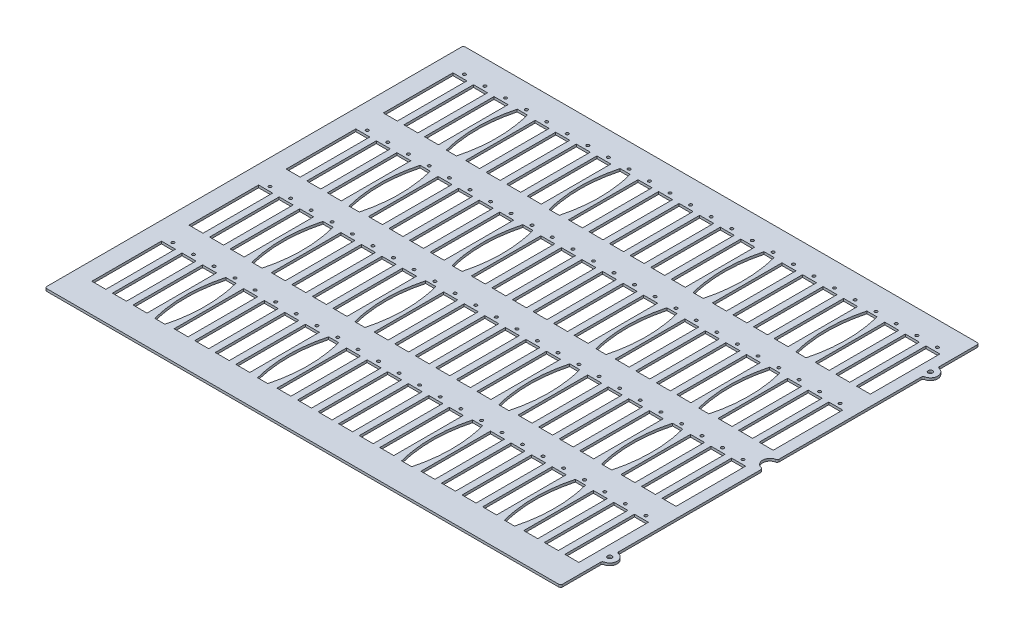
from build123d import *

# Parameters (mm, degrees)
BOSS_EXTRUDE1_DEPTH        = 3.175
SKETCH2_R                  = 1.905
SKETCH2_W                  = 18.288
SKETCH2_H                  = 90.932
CUT_EXTRUDE1_DEPTH         = 3.175
SKETCH3_R                  = 1.905
CUT_EXTRUDE2_DEPTH         = 3.175
F_1_0_228_DIAMETER_HOLE1_D = 5.7912
FILLET1_R                  = 2.54


with BuildPart() as part:
    # Sketch1 → Boss-Extrude1 (new body)
    with BuildSketch(Plane(origin=(0, 0, 0), x_dir=(1, 0, 0), z_dir=(0, 1, 0))):
        with BuildLine():
            Line((337.058, 219.456), (337.058, 273.558))
            Line((337.058, 273.558), (-337.058, 273.558))
            Line((-337.058, 273.558), (-337.058, -273.558))
            Line((-337.058, -273.558), (337.058, -273.558))
            Line((337.058, -273.558), (337.058, -218.948))
            ThreePointArc((337.058, -218.948), (346.71, -209.296), (337.058, -199.644))
            Line((337.058, -199.644), (337.058, -9.398))
            ThreePointArc((337.058, -9.398), (327.406, 0.254), (337.058, 9.906))
            Line((337.058, 9.906), (337.058, 200.152))
            ThreePointArc((337.058, 200.152), (346.71, 209.804), (337.058, 219.456))
        make_face()
    extrude(amount=BOSS_EXTRUDE1_DEPTH)

    # Sketch2 → Cut-Extrude1 (cut)
    with BuildSketch(Plane(origin=(0, 3.175, 0), x_dir=(1, 0, 0), z_dir=(0, 1, 0))):
        with Locations((-304.313166667, 242.062)):
            Circle(SKETCH2_R)
        with Locations((-277.4315, 242.062)):
            Circle(SKETCH2_R)
        with Locations((-250.549833333, 242.062)):
            Circle(SKETCH2_R)
        with Locations((-196.7865, 242.062)):
            Circle(SKETCH2_R)
        with Locations((-169.904833333, 242.062)):
            Circle(SKETCH2_R)
        with Locations((-143.023166667, 242.062)):
            Circle(SKETCH2_R)
        with Locations((-116.1415, 242.062)):
            Circle(SKETCH2_R)
        with Locations((-62.378166667, 242.062)):
            Circle(SKETCH2_R)
        with Locations((-35.4965, 242.062)):
            Circle(SKETCH2_R)
        with Locations((-8.614833333, 242.062)):
            Circle(SKETCH2_R)
        with Locations((18.266833333, 242.062)):
            Circle(SKETCH2_R)
        with Locations((45.1485, 242.062)):
            Circle(SKETCH2_R)
        with Locations((72.030166667, 242.062)):
            Circle(SKETCH2_R)
        with Locations((125.7935, 242.062)):
            Circle(SKETCH2_R)
        with Locations((152.675166667, 242.062)):
            Circle(SKETCH2_R)
        with Locations((179.556833333, 242.062)):
            Circle(SKETCH2_R)
        with Locations((206.4385, 242.062)):
            Circle(SKETCH2_R)
        with Locations((260.201833333, 242.062)):
            Circle(SKETCH2_R)
        with Locations((287.0835, 242.062)):
            Circle(SKETCH2_R)
        with Locations((313.965166667, 242.062)):
            Circle(SKETCH2_R)
        with Locations((-277.4315, 115.062)):
            Circle(SKETCH2_R)
        with Locations((-250.549833333, 115.062)):
            Circle(SKETCH2_R)
        with Locations((-196.7865, 115.062)):
            Circle(SKETCH2_R)
        with Locations((-169.904833333, 115.062)):
            Circle(SKETCH2_R)
        with Locations((-143.023166667, 115.062)):
            Circle(SKETCH2_R)
        with Locations((-116.1415, 115.062)):
            Circle(SKETCH2_R)
        with Locations((-62.378166667, 115.062)):
            Circle(SKETCH2_R)
        with Locations((-35.4965, 115.062)):
            Circle(SKETCH2_R)
        with Locations((-8.614833333, 115.062)):
            Circle(SKETCH2_R)
        with Locations((18.266833333, 115.062)):
            Circle(SKETCH2_R)
        with Locations((45.1485, 115.062)):
            Circle(SKETCH2_R)
        with Locations((72.030166667, 115.062)):
            Circle(SKETCH2_R)
        with Locations((125.7935, 115.062)):
            Circle(SKETCH2_R)
        with Locations((152.675166667, 115.062)):
            Circle(SKETCH2_R)
        with Locations((179.556833333, 115.062)):
            Circle(SKETCH2_R)
        with Locations((206.4385, 115.062)):
            Circle(SKETCH2_R)
        with Locations((260.201833333, 115.062)):
            Circle(SKETCH2_R)
        with Locations((287.0835, 115.062)):
            Circle(SKETCH2_R)
        with Locations((313.965166667, 115.062)):
            Circle(SKETCH2_R)
        with Locations((-277.4315, -11.938)):
            Circle(SKETCH2_R)
        with Locations((-250.549833333, -11.938)):
            Circle(SKETCH2_R)
        with Locations((-196.7865, -11.938)):
            Circle(SKETCH2_R)
        with Locations((-169.904833333, -11.938)):
            Circle(SKETCH2_R)
        with Locations((-143.023166667, -11.938)):
            Circle(SKETCH2_R)
        with Locations((-116.1415, -11.938)):
            Circle(SKETCH2_R)
        with Locations((-62.378166667, -11.938)):
            Circle(SKETCH2_R)
        with Locations((-35.4965, -11.938)):
            Circle(SKETCH2_R)
        with Locations((-8.614833333, -11.938)):
            Circle(SKETCH2_R)
        with Locations((18.266833333, -11.938)):
            Circle(SKETCH2_R)
        with Locations((45.1485, -11.938)):
            Circle(SKETCH2_R)
        with Locations((72.030166667, -11.938)):
            Circle(SKETCH2_R)
        with Locations((125.7935, -11.938)):
            Circle(SKETCH2_R)
        with Locations((152.675166667, -11.938)):
            Circle(SKETCH2_R)
        with Locations((179.556833333, -11.938)):
            Circle(SKETCH2_R)
        with Locations((206.4385, -11.938)):
            Circle(SKETCH2_R)
        with Locations((260.201833333, -11.938)):
            Circle(SKETCH2_R)
        with Locations((287.0835, -11.938)):
            Circle(SKETCH2_R)
        with Locations((313.965166667, -11.938)):
            Circle(SKETCH2_R)
        with Locations((-277.4315, -138.938)):
            Circle(SKETCH2_R)
        with Locations((-250.549833333, -138.938)):
            Circle(SKETCH2_R)
        with Locations((-196.7865, -138.938)):
            Circle(SKETCH2_R)
        with Locations((-169.904833333, -138.938)):
            Circle(SKETCH2_R)
        with Locations((-143.023166667, -138.938)):
            Circle(SKETCH2_R)
        with Locations((-116.1415, -138.938)):
            Circle(SKETCH2_R)
        with Locations((-62.378166667, -138.938)):
            Circle(SKETCH2_R)
        with Locations((-35.4965, -138.938)):
            Circle(SKETCH2_R)
        with Locations((-8.614833333, -138.938)):
            Circle(SKETCH2_R)
        with Locations((18.266833333, -138.938)):
            Circle(SKETCH2_R)
        with Locations((45.1485, -138.938)):
            Circle(SKETCH2_R)
        with Locations((72.030166667, -138.938)):
            Circle(SKETCH2_R)
        with Locations((125.7935, -138.938)):
            Circle(SKETCH2_R)
        with Locations((152.675166667, -138.938)):
            Circle(SKETCH2_R)
        with Locations((179.556833333, -138.938)):
            Circle(SKETCH2_R)
        with Locations((206.4385, -138.938)):
            Circle(SKETCH2_R)
        with Locations((260.201833333, -138.938)):
            Circle(SKETCH2_R)
        with Locations((287.0835, -138.938)):
            Circle(SKETCH2_R)
        with Locations((313.965166667, -138.938)):
            Circle(SKETCH2_R)
        with Locations((-304.313166667, 115.062)):
            Circle(SKETCH2_R)
        with Locations((-304.313166667, -11.938)):
            Circle(SKETCH2_R)
        with Locations((-304.313166667, -138.938)):
            Circle(SKETCH2_R)
        with Locations((-277.4315, 190.754)):
            Rectangle(SKETCH2_W, SKETCH2_H)
        with Locations((-304.313166667, 190.754)):
            Rectangle(SKETCH2_W, SKETCH2_H)
        with Locations((-250.549833333, 190.754)):
            Rectangle(SKETCH2_W, SKETCH2_H)
        with Locations((-196.7865, 190.754)):
            Rectangle(SKETCH2_W, SKETCH2_H)
        with Locations((-169.904833333, 190.754)):
            Rectangle(SKETCH2_W, SKETCH2_H)
        with Locations((-143.023166667, 190.754)):
            Rectangle(SKETCH2_W, SKETCH2_H)
        with Locations((-116.1415, 190.754)):
            Rectangle(SKETCH2_W, SKETCH2_H)
        with Locations((-62.378166667, 190.754)):
            Rectangle(SKETCH2_W, SKETCH2_H)
        with Locations((-35.4965, 190.754)):
            Rectangle(SKETCH2_W, SKETCH2_H)
        with Locations((-8.614833333, 190.754)):
            Rectangle(SKETCH2_W, SKETCH2_H)
        with Locations((18.266833333, 190.754)):
            Rectangle(SKETCH2_W, SKETCH2_H)
        with Locations((45.1485, 190.754)):
            Rectangle(SKETCH2_W, SKETCH2_H)
        with Locations((72.030166667, 190.754)):
            Rectangle(SKETCH2_W, SKETCH2_H)
        with Locations((125.7935, 190.754)):
            Rectangle(SKETCH2_W, SKETCH2_H)
        with Locations((152.675166667, 190.754)):
            Rectangle(SKETCH2_W, SKETCH2_H)
        with Locations((179.556833333, 190.754)):
            Rectangle(SKETCH2_W, SKETCH2_H)
        with Locations((206.4385, 190.754)):
            Rectangle(SKETCH2_W, SKETCH2_H)
        with Locations((260.201833333, 190.754)):
            Rectangle(SKETCH2_W, SKETCH2_H)
        with Locations((287.0835, 190.754)):
            Rectangle(SKETCH2_W, SKETCH2_H)
        with Locations((313.965166667, 190.754)):
            Rectangle(SKETCH2_W, SKETCH2_H)
        with Locations((-277.4315, 63.754)):
            Rectangle(SKETCH2_W, SKETCH2_H)
        with Locations((-250.549833333, 63.754)):
            Rectangle(SKETCH2_W, SKETCH2_H)
        with Locations((-196.7865, 63.754)):
            Rectangle(SKETCH2_W, SKETCH2_H)
        with Locations((-169.904833333, 63.754)):
            Rectangle(SKETCH2_W, SKETCH2_H)
        with Locations((-143.023166667, 63.754)):
            Rectangle(SKETCH2_W, SKETCH2_H)
        with Locations((-116.1415, 63.754)):
            Rectangle(SKETCH2_W, SKETCH2_H)
        with Locations((-62.378166667, 63.754)):
            Rectangle(SKETCH2_W, SKETCH2_H)
        with Locations((-35.4965, 63.754)):
            Rectangle(SKETCH2_W, SKETCH2_H)
        with Locations((-8.614833333, 63.754)):
            Rectangle(SKETCH2_W, SKETCH2_H)
        with Locations((18.266833333, 63.754)):
            Rectangle(SKETCH2_W, SKETCH2_H)
        with Locations((45.1485, 63.754)):
            Rectangle(SKETCH2_W, SKETCH2_H)
        with Locations((72.030166667, 63.754)):
            Rectangle(SKETCH2_W, SKETCH2_H)
        with Locations((125.7935, 63.754)):
            Rectangle(SKETCH2_W, SKETCH2_H)
        with Locations((152.675166667, 63.754)):
            Rectangle(SKETCH2_W, SKETCH2_H)
        with Locations((179.556833333, 63.754)):
            Rectangle(SKETCH2_W, SKETCH2_H)
        with Locations((206.4385, 63.754)):
            Rectangle(SKETCH2_W, SKETCH2_H)
        with Locations((260.201833333, 63.754)):
            Rectangle(SKETCH2_W, SKETCH2_H)
        with Locations((287.0835, 63.754)):
            Rectangle(SKETCH2_W, SKETCH2_H)
        with Locations((313.965166667, 63.754)):
            Rectangle(SKETCH2_W, SKETCH2_H)
        with Locations((-277.4315, -63.246)):
            Rectangle(SKETCH2_W, SKETCH2_H)
        with Locations((-250.549833333, -63.246)):
            Rectangle(SKETCH2_W, SKETCH2_H)
        with Locations((-196.7865, -63.246)):
            Rectangle(SKETCH2_W, SKETCH2_H)
        with Locations((-169.904833333, -63.246)):
            Rectangle(SKETCH2_W, SKETCH2_H)
        with Locations((-143.023166667, -63.246)):
            Rectangle(SKETCH2_W, SKETCH2_H)
        with Locations((-116.1415, -63.246)):
            Rectangle(SKETCH2_W, SKETCH2_H)
        with Locations((-62.378166667, -63.246)):
            Rectangle(SKETCH2_W, SKETCH2_H)
        with Locations((-35.4965, -63.246)):
            Rectangle(SKETCH2_W, SKETCH2_H)
        with Locations((-8.614833333, -63.246)):
            Rectangle(SKETCH2_W, SKETCH2_H)
        with Locations((18.266833333, -63.246)):
            Rectangle(SKETCH2_W, SKETCH2_H)
        with Locations((45.1485, -63.246)):
            Rectangle(SKETCH2_W, SKETCH2_H)
        with Locations((72.030166667, -63.246)):
            Rectangle(SKETCH2_W, SKETCH2_H)
        with Locations((125.7935, -63.246)):
            Rectangle(SKETCH2_W, SKETCH2_H)
        with Locations((152.675166667, -63.246)):
            Rectangle(SKETCH2_W, SKETCH2_H)
        with Locations((179.556833333, -63.246)):
            Rectangle(SKETCH2_W, SKETCH2_H)
        with Locations((206.4385, -63.246)):
            Rectangle(SKETCH2_W, SKETCH2_H)
        with Locations((260.201833333, -63.246)):
            Rectangle(SKETCH2_W, SKETCH2_H)
        with Locations((287.0835, -63.246)):
            Rectangle(SKETCH2_W, SKETCH2_H)
        with Locations((313.965166667, -63.246)):
            Rectangle(SKETCH2_W, SKETCH2_H)
        with Locations((-277.4315, -190.246)):
            Rectangle(SKETCH2_W, SKETCH2_H)
        with Locations((-250.549833333, -190.246)):
            Rectangle(SKETCH2_W, SKETCH2_H)
        with Locations((-196.7865, -190.246)):
            Rectangle(SKETCH2_W, SKETCH2_H)
        with Locations((-169.904833333, -190.246)):
            Rectangle(SKETCH2_W, SKETCH2_H)
        with Locations((-143.023166667, -190.246)):
            Rectangle(SKETCH2_W, SKETCH2_H)
        with Locations((-116.1415, -190.246)):
            Rectangle(SKETCH2_W, SKETCH2_H)
        with Locations((-62.378166667, -190.246)):
            Rectangle(SKETCH2_W, SKETCH2_H)
        with Locations((-35.4965, -190.246)):
            Rectangle(SKETCH2_W, SKETCH2_H)
        with Locations((-8.614833333, -190.246)):
            Rectangle(SKETCH2_W, SKETCH2_H)
        with Locations((18.266833333, -190.246)):
            Rectangle(SKETCH2_W, SKETCH2_H)
        with Locations((45.1485, -190.246)):
            Rectangle(SKETCH2_W, SKETCH2_H)
        with Locations((72.030166667, -190.246)):
            Rectangle(SKETCH2_W, SKETCH2_H)
        with Locations((125.7935, -190.246)):
            Rectangle(SKETCH2_W, SKETCH2_H)
        with Locations((152.675166667, -190.246)):
            Rectangle(SKETCH2_W, SKETCH2_H)
        with Locations((179.556833333, -190.246)):
            Rectangle(SKETCH2_W, SKETCH2_H)
        with Locations((206.4385, -190.246)):
            Rectangle(SKETCH2_W, SKETCH2_H)
        with Locations((260.201833333, -190.246)):
            Rectangle(SKETCH2_W, SKETCH2_H)
        with Locations((287.0835, -190.246)):
            Rectangle(SKETCH2_W, SKETCH2_H)
        with Locations((313.965166667, -190.246)):
            Rectangle(SKETCH2_W, SKETCH2_H)
        with Locations((-304.313166667, 63.754)):
            Rectangle(SKETCH2_W, SKETCH2_H)
        with Locations((-304.313166667, -63.246)):
            Rectangle(SKETCH2_W, SKETCH2_H)
        with Locations((-304.313166667, -190.246)):
            Rectangle(SKETCH2_W, SKETCH2_H)
    extrude(amount=-CUT_EXTRUDE1_DEPTH, mode=Mode.SUBTRACT)

    # Sketch3 → Cut-Extrude2 (cut)
    with BuildSketch(Plane(origin=(0, 3.175, 0), x_dir=(1, 0, 0), z_dir=(0, 1, 0))):
        with Locations((-223.668166667, 242.443)):
            Circle(SKETCH3_R)
        with Locations((-89.259833333, 242.443)):
            Circle(SKETCH3_R)
        with Locations((-89.259833333, 115.443)):
            Circle(SKETCH3_R)
        with Locations((-89.259833333, -11.557)):
            Circle(SKETCH3_R)
        with Locations((-89.259833333, -138.557)):
            Circle(SKETCH3_R)
        with Locations((-223.668166667, 115.443)):
            Circle(SKETCH3_R)
        with Locations((-223.668166667, -11.557)):
            Circle(SKETCH3_R)
        with Locations((-223.668166667, -138.557)):
            Circle(SKETCH3_R)
        with Locations((98.911833333, 242.443)):
            Circle(SKETCH3_R)
        with Locations((98.911833333, 115.443)):
            Circle(SKETCH3_R)
        with Locations((98.911833333, -11.557)):
            Circle(SKETCH3_R)
        with Locations((98.911833333, -138.557)):
            Circle(SKETCH3_R)
        with Locations((233.320166667, 242.443)):
            Circle(SKETCH3_R)
        with Locations((233.320166667, 115.443)):
            Circle(SKETCH3_R)
        with Locations((233.320166667, -11.557)):
            Circle(SKETCH3_R)
        with Locations((233.320166667, -138.557)):
            Circle(SKETCH3_R)
        with BuildLine():
            Line((-95.863833333, 237.109), (-82.655833333, 237.109))
            add(Edge.make_bspline(
                [(-82.655833333, 237.109), (-70.463833333, 190.754), (-82.655833333, 144.399)],
                knots=[0, 0, 0, 1, 1, 1], degree=2))
            Line((-82.655833333, 144.399), (-95.863833333, 144.399))
            add(Edge.make_bspline(
                [(-95.863833333, 237.109), (-108.055833333, 190.754), (-95.863833333, 144.399)],
                knots=[0, 0, 0, 1, 1, 1], degree=2))
        make_face()
        with BuildLine():
            Line((-230.272166667, 144.399), (-217.064166667, 144.399))
            add(Edge.make_bspline(
                [(-217.064166667, 237.109), (-204.872166667, 190.754), (-217.064166667, 144.399)],
                knots=[0, 0, 0, 1, 1, 1], degree=2))
            Line((-217.064166667, 237.109), (-230.272166667, 237.109))
            add(Edge.make_bspline(
                [(-230.272166667, 237.109), (-242.464166667, 190.754), (-230.272166667, 144.399)],
                knots=[0, 0, 0, 1, 1, 1], degree=2))
        make_face()
        with BuildLine():
            Line((-95.863833333, 110.109), (-82.655833333, 110.109))
            add(Edge.make_bspline(
                [(-82.655833333, 110.109), (-70.463833333, 63.754), (-82.655833333, 17.399)],
                knots=[0, 0, 0, 1, 1, 1], degree=2))
            Line((-82.655833333, 17.399), (-95.863833333, 17.399))
            add(Edge.make_bspline(
                [(-95.863833333, 110.109), (-108.055833333, 63.754), (-95.863833333, 17.399)],
                knots=[0, 0, 0, 1, 1, 1], degree=2))
        make_face()
        with BuildLine():
            Line((-95.863833333, -16.891), (-82.655833333, -16.891))
            add(Edge.make_bspline(
                [(-82.655833333, -16.891), (-70.463833333, -63.246), (-82.655833333, -109.601)],
                knots=[0, 0, 0, 1, 1, 1], degree=2))
            Line((-82.655833333, -109.601), (-95.863833333, -109.601))
            add(Edge.make_bspline(
                [(-95.863833333, -16.891), (-108.055833333, -63.246), (-95.863833333, -109.601)],
                knots=[0, 0, 0, 1, 1, 1], degree=2))
        make_face()
        with BuildLine():
            Line((-95.863833333, -143.891), (-82.655833333, -143.891))
            add(Edge.make_bspline(
                [(-82.655833333, -143.891), (-70.463833333, -190.246), (-82.655833333, -236.601)],
                knots=[0, 0, 0, 1, 1, 1], degree=2))
            Line((-82.655833333, -236.601), (-95.863833333, -236.601))
            add(Edge.make_bspline(
                [(-95.863833333, -143.891), (-108.055833333, -190.246), (-95.863833333, -236.601)],
                knots=[0, 0, 0, 1, 1, 1], degree=2))
        make_face()
        with BuildLine():
            Line((-230.272166667, 110.109), (-217.064166667, 110.109))
            add(Edge.make_bspline(
                [(-217.064166667, 110.109), (-204.872166667, 63.754), (-217.064166667, 17.399)],
                knots=[0, 0, 0, 1, 1, 1], degree=2))
            Line((-217.064166667, 17.399), (-230.272166667, 17.399))
            add(Edge.make_bspline(
                [(-230.272166667, 110.109), (-242.464166667, 63.754), (-230.272166667, 17.399)],
                knots=[0, 0, 0, 1, 1, 1], degree=2))
        make_face()
        with BuildLine():
            Line((-230.272166667, -16.891), (-217.064166667, -16.891))
            add(Edge.make_bspline(
                [(-217.064166667, -16.891), (-204.872166667, -63.246), (-217.064166667, -109.601)],
                knots=[0, 0, 0, 1, 1, 1], degree=2))
            Line((-217.064166667, -109.601), (-230.272166667, -109.601))
            add(Edge.make_bspline(
                [(-230.272166667, -16.891), (-242.464166667, -63.246), (-230.272166667, -109.601)],
                knots=[0, 0, 0, 1, 1, 1], degree=2))
        make_face()
        with BuildLine():
            Line((-230.272166667, -143.891), (-217.064166667, -143.891))
            add(Edge.make_bspline(
                [(-217.064166667, -143.891), (-204.872166667, -190.246), (-217.064166667, -236.601)],
                knots=[0, 0, 0, 1, 1, 1], degree=2))
            Line((-217.064166667, -236.601), (-230.272166667, -236.601))
            add(Edge.make_bspline(
                [(-230.272166667, -143.891), (-242.464166667, -190.246), (-230.272166667, -236.601)],
                knots=[0, 0, 0, 1, 1, 1], degree=2))
        make_face()
        with BuildLine():
            Line((92.307833333, 237.109), (105.515833333, 237.109))
            add(Edge.make_bspline(
                [(105.515833333, 237.109), (117.707833333, 190.754), (105.515833333, 144.399)],
                knots=[0, 0, 0, 1, 1, 1], degree=2))
            Line((105.515833333, 144.399), (92.307833333, 144.399))
            add(Edge.make_bspline(
                [(92.307833333, 237.109), (80.115833333, 190.754), (92.307833333, 144.399)],
                knots=[0, 0, 0, 1, 1, 1], degree=2))
        make_face()
        with BuildLine():
            Line((92.307833333, 110.109), (105.515833333, 110.109))
            add(Edge.make_bspline(
                [(105.515833333, 110.109), (117.707833333, 63.754), (105.515833333, 17.399)],
                knots=[0, 0, 0, 1, 1, 1], degree=2))
            Line((105.515833333, 17.399), (92.307833333, 17.399))
            add(Edge.make_bspline(
                [(92.307833333, 110.109), (80.115833333, 63.754), (92.307833333, 17.399)],
                knots=[0, 0, 0, 1, 1, 1], degree=2))
        make_face()
        with BuildLine():
            Line((92.307833333, -16.891), (105.515833333, -16.891))
            add(Edge.make_bspline(
                [(105.515833333, -16.891), (117.707833333, -63.246), (105.515833333, -109.601)],
                knots=[0, 0, 0, 1, 1, 1], degree=2))
            Line((105.515833333, -109.601), (92.307833333, -109.601))
            add(Edge.make_bspline(
                [(92.307833333, -16.891), (80.115833333, -63.246), (92.307833333, -109.601)],
                knots=[0, 0, 0, 1, 1, 1], degree=2))
        make_face()
        with BuildLine():
            Line((92.307833333, -143.891), (105.515833333, -143.891))
            add(Edge.make_bspline(
                [(105.515833333, -143.891), (117.707833333, -190.246), (105.515833333, -236.601)],
                knots=[0, 0, 0, 1, 1, 1], degree=2))
            Line((105.515833333, -236.601), (92.307833333, -236.601))
            add(Edge.make_bspline(
                [(92.307833333, -143.891), (80.115833333, -190.246), (92.307833333, -236.601)],
                knots=[0, 0, 0, 1, 1, 1], degree=2))
        make_face()
        with BuildLine():
            Line((226.716166667, 237.109), (239.924166667, 237.109))
            add(Edge.make_bspline(
                [(239.924166667, 237.109), (252.116166667, 190.754), (239.924166667, 144.399)],
                knots=[0, 0, 0, 1, 1, 1], degree=2))
            Line((239.924166667, 144.399), (226.716166667, 144.399))
            add(Edge.make_bspline(
                [(226.716166667, 237.109), (214.524166667, 190.754), (226.716166667, 144.399)],
                knots=[0, 0, 0, 1, 1, 1], degree=2))
        make_face()
        with BuildLine():
            Line((226.716166667, 110.109), (239.924166667, 110.109))
            add(Edge.make_bspline(
                [(239.924166667, 110.109), (252.116166667, 63.754), (239.924166667, 17.399)],
                knots=[0, 0, 0, 1, 1, 1], degree=2))
            Line((239.924166667, 17.399), (226.716166667, 17.399))
            add(Edge.make_bspline(
                [(226.716166667, 110.109), (214.524166667, 63.754), (226.716166667, 17.399)],
                knots=[0, 0, 0, 1, 1, 1], degree=2))
        make_face()
        with BuildLine():
            Line((226.716166667, -16.891), (239.924166667, -16.891))
            add(Edge.make_bspline(
                [(239.924166667, -16.891), (252.116166667, -63.246), (239.924166667, -109.601)],
                knots=[0, 0, 0, 1, 1, 1], degree=2))
            Line((239.924166667, -109.601), (226.716166667, -109.601))
            add(Edge.make_bspline(
                [(226.716166667, -16.891), (214.524166667, -63.246), (226.716166667, -109.601)],
                knots=[0, 0, 0, 1, 1, 1], degree=2))
        make_face()
        with BuildLine():
            Line((226.716166667, -143.891), (239.924166667, -143.891))
            add(Edge.make_bspline(
                [(239.924166667, -143.891), (252.116166667, -190.246), (239.924166667, -236.601)],
                knots=[0, 0, 0, 1, 1, 1], degree=2))
            Line((239.924166667, -236.601), (226.716166667, -236.601))
            add(Edge.make_bspline(
                [(226.716166667, -143.891), (214.524166667, -190.246), (226.716166667, -236.601)],
                knots=[0, 0, 0, 1, 1, 1], degree=2))
        make_face()
    extrude(amount=-CUT_EXTRUDE2_DEPTH, mode=Mode.SUBTRACT)

    # #1 (0.228) Diameter Hole1 (through all)
    with Locations(Plane(origin=(0, 3.175, 0), x_dir=(1, 0, 0), z_dir=(0, 1, 0))):
        with Locations((337.058, 209.804), (337.058, -209.296)):
            Hole(F_1_0_228_DIAMETER_HOLE1_D / 2)

    # Fillet1
    fillet1_edges = [part.edges().sort_by_distance(p)[0] for p in [
        (-337.058, 1.5875, -273.558),
        (-337.058, 1.5875, 273.558),
        (337.058, 1.5875, 273.558),
        (337.058, 1.5875, 218.948),
        (337.058, 1.5875, 199.644),
        (337.058, 1.5875, 9.398),
        (337.058, 1.5875, -9.906),
        (337.058, 1.5875, -200.152),
        (337.058, 1.5875, -273.558),
        (337.058, 1.5875, -219.456),
    ]]
    fillet(fillet1_edges, radius=FILLET1_R)


solid = part.part
